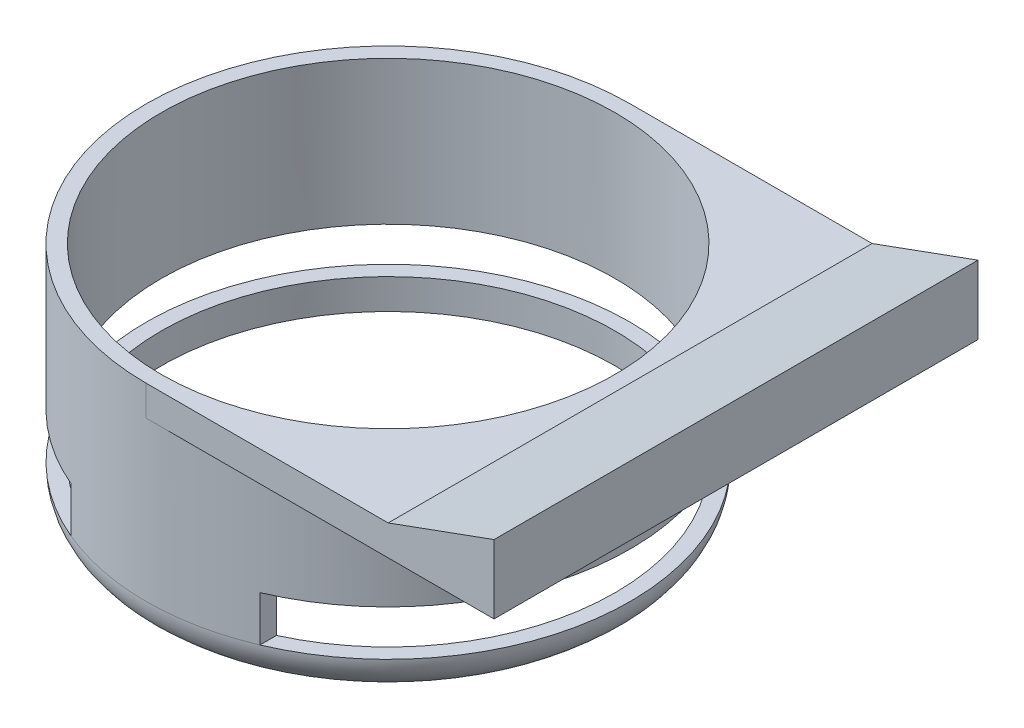
from build123d import *

# Parameters (mm, degrees)
SKETCH1_R               = 40.64
BOSS_EXTRUDE1_DEPTH     = 38.1
FILLET1_R               = 6.35
SKETCH2_R               = 38.1
CUT_EXTRUDE1_DEPTH      = 69.955269559
BOSS_EXTRUDE2_DEPTH     = 5.08
BOSS_EXTRUDE3_DEPTH     = 6.471390766
CUT_EXTRUDE4_DEPTH      = 110.571637256
CUT_EXTRUDE4_DEPTH_BACK = 110.571637256
CUT_EXTRUDE6_DEPTH      = 84.970916887
CUT_EXTRUDE6_DEPTH_BACK = 84.970916887
SKETCH16_W              = 81.28
SKETCH16_H              = 7.62
BOSS_EXTRUDE4_DEPTH     = 7.62


with BuildPart() as part:
    # Sketch1 → Boss-Extrude1 (new body)
    with BuildSketch(Plane(origin=(0, 0, 0), x_dir=(1, 0, 0), z_dir=(0, 1, 0))):
        Circle(SKETCH1_R)
    extrude(amount=BOSS_EXTRUDE1_DEPTH)

    # Fillet1
    fillet1_edges = [part.edges().sort_by_distance(p)[0] for p in [
        (-40.64, 0, 0),
    ]]
    fillet(fillet1_edges, radius=FILLET1_R)

    # Sketch2 → Cut-Extrude1 (cut, through all)
    with BuildSketch(Plane(origin=(0, 38.1, 0), x_dir=(1, 0, 0), z_dir=(0, 1, 0))):
        Circle(SKETCH2_R)
    extrude(amount=-CUT_EXTRUDE1_DEPTH, mode=Mode.SUBTRACT)



with BuildPart() as body_2:
    # Sketch12 → Boss-Extrude2 (new body)
    with BuildSketch(Plane(origin=(0, 38.1, 0), x_dir=(1, 0, 0), z_dir=(0, 1, 0))):
        with BuildLine():
            Line((0, -40.64), (58.42, -40.64))
            Line((58.42, -40.64), (58.42, 40.64))
            Line((58.42, 40.64), (0, 40.64))
            ThreePointArc((0, 40.64), (40.64, 0), (0, -40.64))
        make_face()
    extrude(amount=-BOSS_EXTRUDE2_DEPTH)


with BuildPart() as part_1:
    add(part.part)

    add(body_2.part)  # Boss-Extrude3 merges body 2
    # Sketch13 → Boss-Extrude3 (add)
    with BuildSketch(Plane(origin=(0, 38.1, 0), x_dir=(1, 0, 0), z_dir=(0, 1, 0))):
        Polygon((58.42, 40.64), (40.64, 40.64), (40.64, 0), (40.64, -40.64), (58.42, -40.64), (58.42, 0), align=None)
    extrude(amount=BOSS_EXTRUDE3_DEPTH)

    # Sketch14 → Cut-Extrude4 (cut, two sides: drawn at the far end of the back side and taken through both)
    with BuildSketch(Plane.XY.offset(40.64).offset(-CUT_EXTRUDE4_DEPTH_BACK)):
        Polygon((40.64, 38.1), (58.42, 44.571390766), (40.64, 44.571390766), align=None)
    extrude(amount=CUT_EXTRUDE4_DEPTH + CUT_EXTRUDE4_DEPTH_BACK, mode=Mode.SUBTRACT)

    # Sketch16 → Cut-Extrude6 (cut, two sides: drawn at the far end of the back side and taken through both)
    with BuildSketch(Plane(origin=(0, 0, 0), x_dir=(0, 0, -1), z_dir=(1, 0, 0)).offset(-CUT_EXTRUDE6_DEPTH_BACK)):
        with Locations((0, 10.16)):
            Rectangle(SKETCH16_W, SKETCH16_H)
    extrude(amount=CUT_EXTRUDE6_DEPTH + CUT_EXTRUDE6_DEPTH_BACK, mode=Mode.SUBTRACT)


with BuildPart() as cut_extrude6_piece_1:
    # of the separate pieces the step leaves, piece 1, a body of its own (cut_extrude6_pieces)
    add(part_1.part.solids().sort_by_distance((0, 38.1, 40.64))[0])



with BuildPart() as cut_extrude6_piece_2:
    # of the separate pieces the step leaves, piece 2, a body of its own (cut_extrude6_pieces)
    add(part_1.part.solids().sort_by_distance((40.64, 6.35, 0))[0])


with BuildPart() as cut_extrude6_piece_1_1:
    add(cut_extrude6_piece_1.part)

    add(cut_extrude6_piece_2.part)  # Boss-Extrude4 merges Cut-Extrude6 piece 2
    # Sketch17 → Boss-Extrude4 (add)
    with BuildSketch(Plane(origin=(0, 6.35, 0), x_dir=(1, 0, 0), z_dir=(0, 1, 0))):
        with BuildLine():
            Line((-15.875, -34.635160964), (-15.875, -37.411147737))
            ThreePointArc((-15.875, -37.411147737), (0, -40.64), (15.875, -37.411147737))
            Line((15.875, -37.411147737), (15.875, -34.635160964))
            ThreePointArc((15.875, -34.635160964), (0, -38.1), (-15.875, -34.635160964))
        make_face()
    extrude(amount=BOSS_EXTRUDE4_DEPTH)


solid = cut_extrude6_piece_1_1.part
